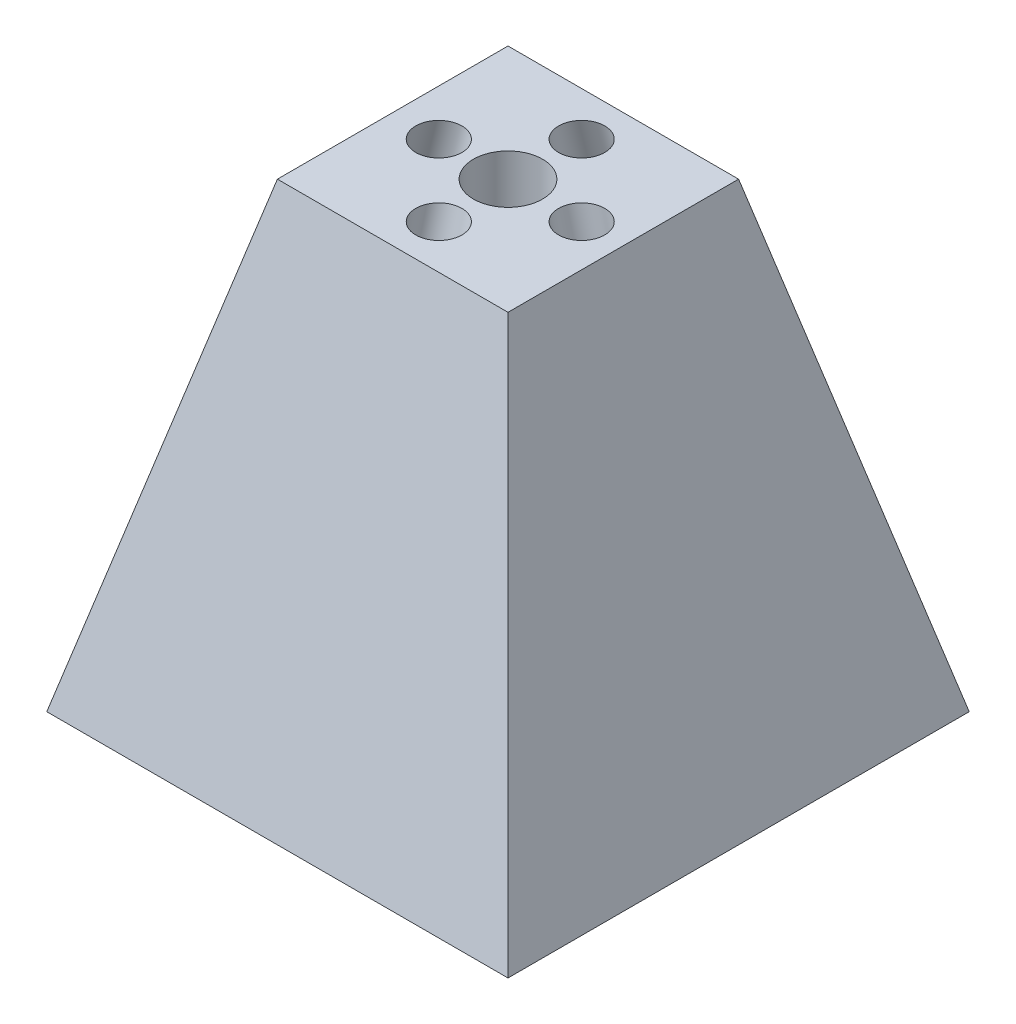
from build123d import *

# Parameters (mm, degrees)
SKETCH4_R           = 5
CIRPATTERN2_START   = -11.032054127
CIRPATTERN2_DEPTH   = 105.5029968
CIRPATTERN2_START_2 = -94.352977596
CIRPATTERN2_2_DEPTH = 105.502996925
CIRPATTERN2_START_3 = -11.032068283
CIRPATTERN2_3_DEPTH = 105.502996925
SKETCH9_R           = 7.5
CUT_EXTRUDE1_DEPTH  = 123.474487302


# Read off the part's stored shape, not the designer's step: CirPattern2
with BuildPart() as part:
    # Sketch1 → Loft1 section 0
    with BuildSketch(Plane(origin=(0, 0, 0), x_dir=(1, 0, 0), z_dir=(0, 1, 0))):
        with BuildLine():
            Line((-50, -50), (50, -50))
            Line((50, -50), (50, 50))
            Line((50, 50), (-50, 50))
            Line((-50, 50), (-50, -50))
        make_face()
    # Sketch2 → Loft1 section 1
    with BuildSketch(Plane(origin=(0, 100, 0), x_dir=(1, 0, 0), z_dir=(0, 1, 0))):
        with BuildLine():
            Line((-25, -25), (25, -25))
            Line((25, -25), (25, 25))
            Line((25, 25), (-25, 25))
            Line((-25, 25), (-25, -25))
        make_face()
    loft()

    # Cut-Sweep1: sweep along a path in Sketch6
    with BuildLine(Plane(origin=(-37.647058824, 9.411764706, 0), x_dir=(0, 0, 1), z_dir=(-0.9701425001453319, 0.24253562503633289, 0))) as cut_sweep1_path:
        Line((0, 93.376215639), (0, -33.366083353))
    # Sketch4 → Cut-Sweep1 (sweep, cut)
    with BuildSketch(Plane(origin=(0, 100, 0), x_dir=(1, 0, 0), z_dir=(0, 1, 0))):
        with Locations((-15, 0)):
            Circle(SKETCH4_R)
    sweep(path=cut_sweep1_path.line, mode=Mode.SUBTRACT)

    # CirPattern2 outline → CirPattern2 (cut)
    with BuildSketch(Plane(origin=(0, 0, 0), x_dir=(1, 0, 0), z_dir=(0, 0.970142500145332, -0.2425356250363331)).offset(CIRPATTERN2_START)):
        with BuildLine():
            add(Edge.make_bspline(
                [(5.486382989, -39.277504189), (5.486382989, -29.576079188), (-4.513617011, -29.576079188), (-4.513617011, -39.277504189), (-4.513617011, -48.97892919), (5.486382989, -48.97892919), (5.486382989, -39.277504189)],
                knots=[0, 0, 0, 0, 0.5, 0.5, 0.5, 1, 1, 1, 1], degree=3, weights=[1, 0.333333333, 0.333333333, 1, 0.333333333, 0.333333333, 1]))
        make_face()
    extrude(amount=CIRPATTERN2_DEPTH, mode=Mode.SUBTRACT)

    # CirPattern2 2 outline → CirPattern2 2 (cut)
    with BuildSketch(Plane(origin=(0, 0, 0), x_dir=(0.9701425001453318, 0.24253562503633344, 0), z_dir=(0.24253562503633344, -0.9701425001453318, 0)).offset(CIRPATTERN2_START_2)):
        with BuildLine():
            add(Edge.make_bspline(
                [(39.749364998, -5.000058368), (30.047939997, -5.000058368), (30.047939997, 4.999941632), (39.749364998, 4.999941632), (49.450789999, 4.999941632), (49.450789999, -5.000058368), (39.749364998, -5.000058368)],
                knots=[0, 0, 0, 0, 0.5, 0.5, 0.5, 1, 1, 1, 1], degree=3, weights=[1, 0.333333333, 0.333333333, 1, 0.333333333, 0.333333333, 1]))
        make_face()
    extrude(amount=CIRPATTERN2_2_DEPTH, mode=Mode.SUBTRACT)

    # CirPattern2 3 outline → CirPattern2 3 (cut)
    with BuildSketch(Plane(origin=(0, 0, 0), x_dir=(1, 0, 0), z_dir=(0, 0.9701425001453319, 0.24253562503633325)).offset(CIRPATTERN2_START_3)):
        with BuildLine():
            add(Edge.make_bspline(
                [(-4.513675379, 39.277560815), (-4.513675379, 29.576135813), (5.486324621, 29.576135813), (5.486324621, 39.277560815), (5.486324621, 48.978985816), (-4.513675379, 48.978985816), (-4.513675379, 39.277560815)],
                knots=[0, 0, 0, 0, 0.5, 0.5, 0.5, 1, 1, 1, 1], degree=3, weights=[1, 0.333333333, 0.333333333, 1, 0.333333333, 0.333333333, 1]))
        make_face()
    extrude(amount=CIRPATTERN2_3_DEPTH, mode=Mode.SUBTRACT)

    # Sketch9 → Cut-Extrude1 (cut, through all)
    with BuildSketch(Plane(origin=(0, 100, 0), x_dir=(1, 0, 0), z_dir=(0, 1, 0))):
        with Locations(Location((0, 0, 0), (0, 0, 270))):
            Circle(SKETCH9_R)
    extrude(amount=-CUT_EXTRUDE1_DEPTH, mode=Mode.SUBTRACT)


solid = part.part
